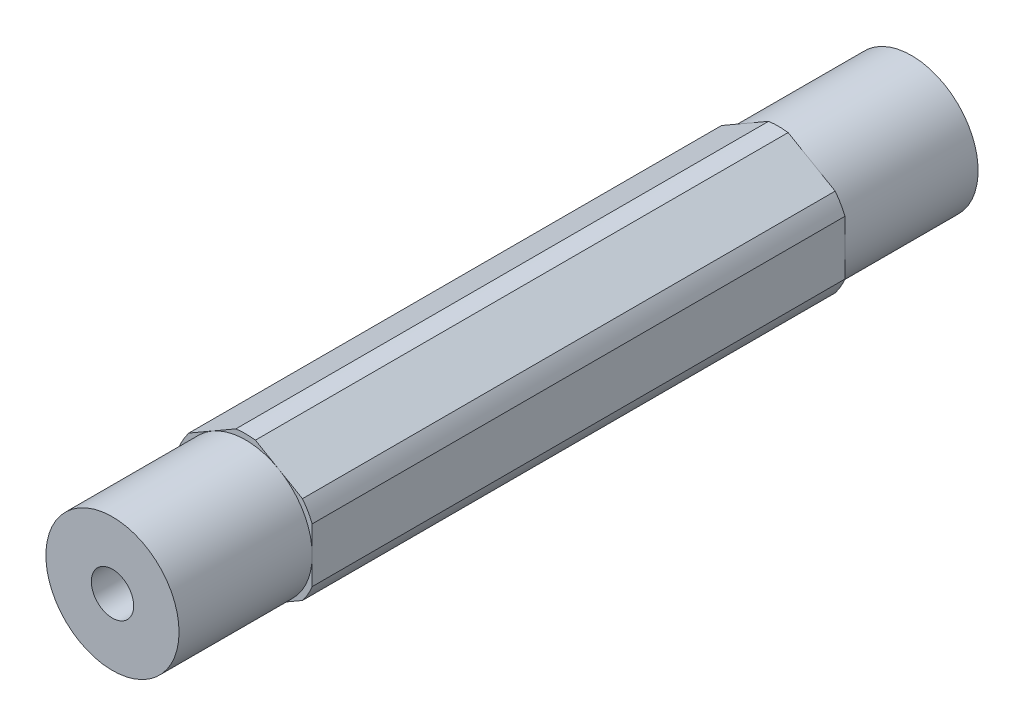
from build123d import *

# Parameters (mm, degrees)
BOSS_EXTRUDE1_DEPTH = 38.1
SKETCH2_R           = 2.0193
CUT_EXTRUDE1_DEPTH  = 77.814880286
SKETCH4_R           = 7.332348419
SKETCH4_R_2         = 6.858
CUT_EXTRUDE2_DEPTH  = 77.814880286
SKETCH5_R           = 6.858
SKETCH5_R_2         = 6.35
CUT_EXTRUDE3_DEPTH  = 12.7
CUT_EXTRUDE4_START  = -12.7
SKETCH6_R           = 6.858
SKETCH6_R_2         = 6.35
CUT_EXTRUDE4_DEPTH  = 12.7


with BuildPart() as part:
    # Sketch1 → Boss-Extrude1 (new, symmetric)
    with BuildSketch(Plane.XY):
        Polygon((0, 7.332348419), (-6.35, 3.666174209), (-6.35, -3.666174209), (0, -7.332348419), (6.35, -3.666174209), (6.35, 3.666174209), align=None)
    extrude(amount=BOSS_EXTRUDE1_DEPTH, both=True)

    # Sketch2 → Cut-Extrude1 (cut, through all)
    with BuildSketch(Plane(origin=(0, 0, -38.1), x_dir=(-1, 0, 0), z_dir=(0, 0, -1))):
        Circle(SKETCH2_R)
    extrude(amount=-CUT_EXTRUDE1_DEPTH, mode=Mode.SUBTRACT)

    # Sketch4 → Cut-Extrude2 (cut, through all)
    with BuildSketch(Plane(origin=(0, 0, -38.1), x_dir=(-1, 0, 0), z_dir=(0, 0, -1))):
        Circle(SKETCH4_R)
        Circle(SKETCH4_R_2, mode=Mode.SUBTRACT)
    extrude(amount=-CUT_EXTRUDE2_DEPTH, mode=Mode.SUBTRACT)

    # Sketch5 → Cut-Extrude3 (cut)
    with BuildSketch(Plane(origin=(0, 0, -38.1), x_dir=(-1, 0, 0), z_dir=(0, 0, -1))):
        Circle(SKETCH5_R)
        Circle(SKETCH5_R_2, mode=Mode.SUBTRACT)
    extrude(amount=-CUT_EXTRUDE3_DEPTH, mode=Mode.SUBTRACT)

    # Sketch6 → Cut-Extrude4 (cut)
    with BuildSketch(Plane.XY.offset(38.1).offset(CUT_EXTRUDE4_START)):
        Circle(SKETCH6_R)
        Circle(SKETCH6_R_2, mode=Mode.SUBTRACT)
    extrude(amount=CUT_EXTRUDE4_DEPTH, mode=Mode.SUBTRACT)


solid = part.part
